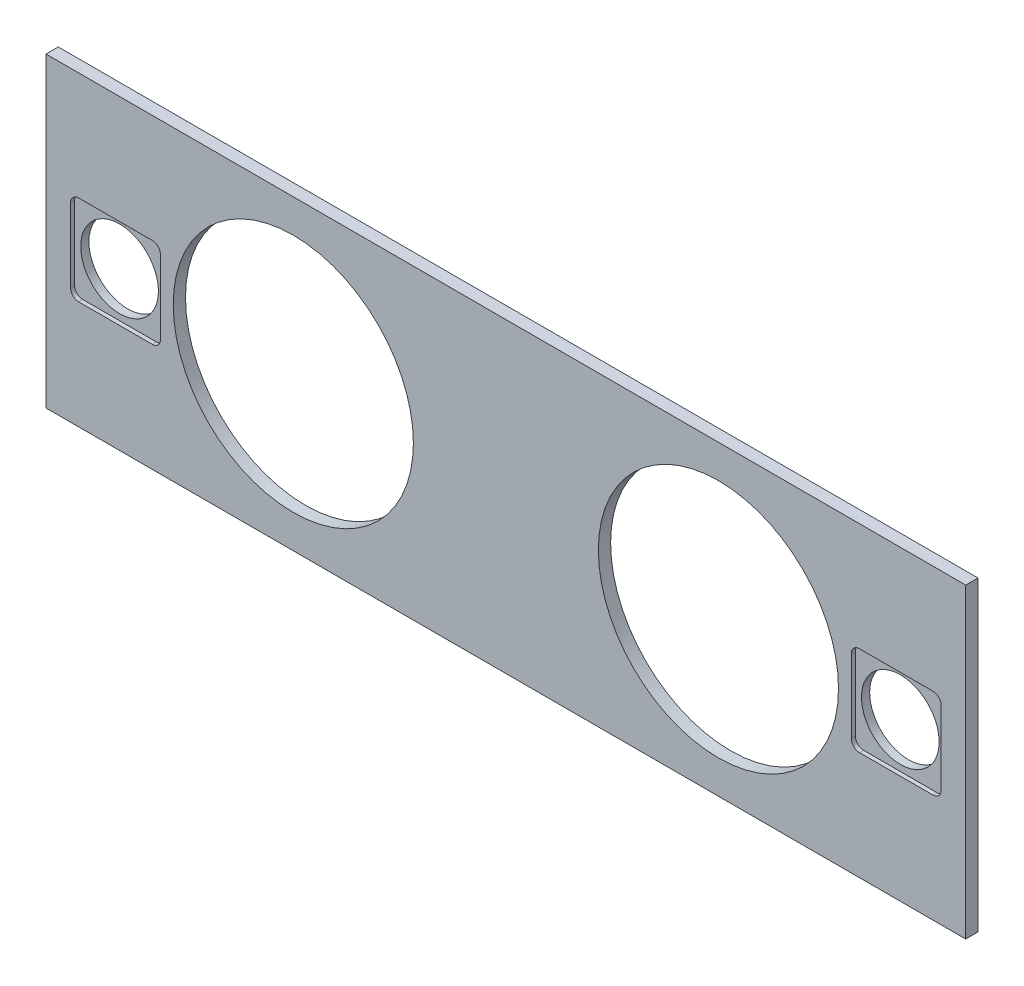
from build123d import *

# Parameters (mm, degrees)
SKETCH1_W           = 900
SKETCH1_H           = 300
SKETCH1_R           = 38
SKETCH1_R_2         = 117.5
BOSS_EXTRUDE1_DEPTH = 12
CUT_EXTRUDE1_DEPTH  = 4


with BuildPart() as part:
    # Sketch1 → Boss-Extrude1 (new body)
    with BuildSketch(Plane.XY):
        with Locations((450, 150)):
            Rectangle(SKETCH1_W, SKETCH1_H)
        with Locations((68, 150)):
            Circle(SKETCH1_R, mode=Mode.SUBTRACT)
        with Locations((242, 150)):
            Circle(SKETCH1_R_2, mode=Mode.SUBTRACT)
        with Locations((658, 150)):
            Circle(SKETCH1_R_2, mode=Mode.SUBTRACT)
        with Locations((832, 150)):
            Circle(SKETCH1_R, mode=Mode.SUBTRACT)
    extrude(amount=BOSS_EXTRUDE1_DEPTH)

    # Sketch4 → Cut-Extrude1 (cut)
    with BuildSketch(Plane.XY.offset(12)):
        with BuildLine():
            Line((32, 194), (104, 194))
            ThreePointArc((104, 194), (109.656854249, 191.656854249), (112, 186))
            Line((112, 186), (112, 114))
            ThreePointArc((112, 114), (109.656854249, 108.343145751), (104, 106))
            Line((104, 106), (32, 106))
            ThreePointArc((32, 106), (26.343145751, 108.343145751), (24, 114))
            Line((24, 114), (24, 186))
            ThreePointArc((24, 186), (26.343145751, 191.656854249), (32, 194))
        make_face()
        with BuildLine():
            Line((868, 106), (796, 106))
            ThreePointArc((796, 106), (790.343145751, 108.343145751), (788, 114))
            Line((788, 114), (788, 186))
            ThreePointArc((788, 186), (790.343145751, 191.656854249), (796, 194))
            Line((796, 194), (868, 194))
            ThreePointArc((868, 194), (873.656854249, 191.656854249), (876, 186))
            Line((876, 186), (876, 114))
            ThreePointArc((876, 114), (873.656854249, 108.343145751), (868, 106))
        make_face()
    extrude(amount=-CUT_EXTRUDE1_DEPTH, mode=Mode.SUBTRACT)


solid = part.part
